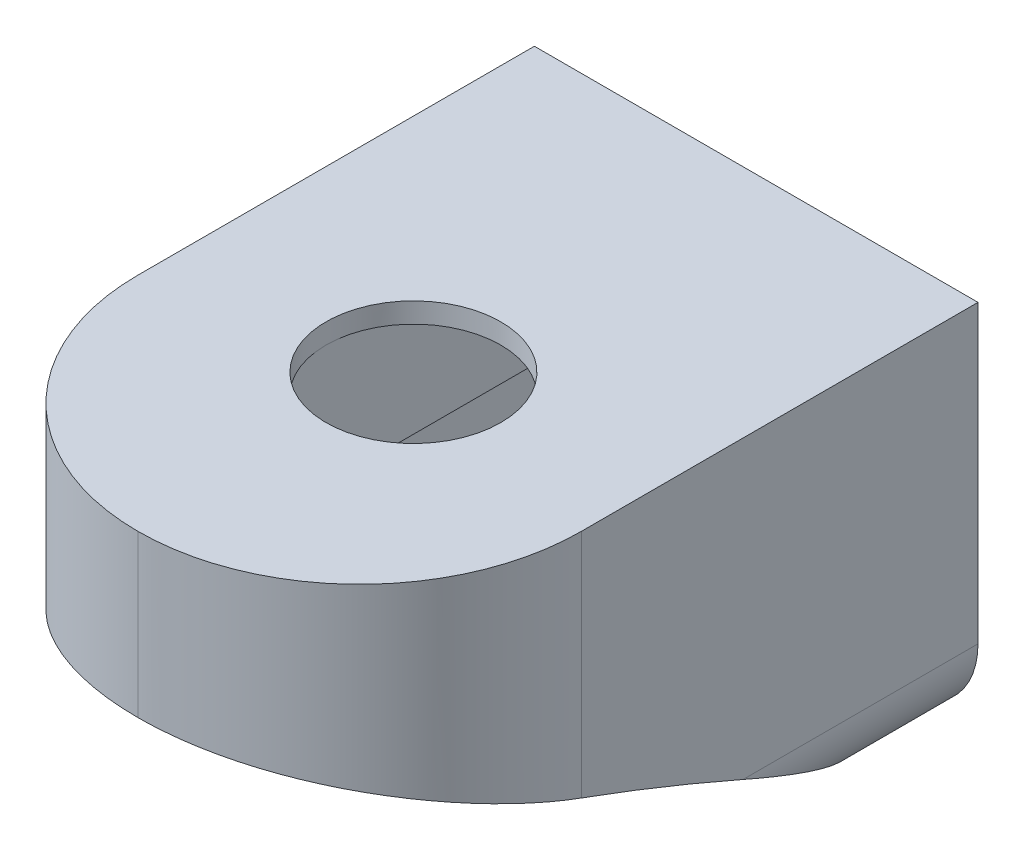
from build123d import *

# Parameters (mm, degrees)
SKETCH1_W           = 33
SKETCH1_H           = 28
BOSS_EXTRUDE1_DEPTH = 46
CUT_EXTRUDE1_DEPTH  = 59.318093247
CUT_EXTRUDE2_START  = -3
CUT_EXTRUDE2_DEPTH  = 27
FILLET1_R           = 12.5
FILLET2_R           = 16.5
FILLET3_R           = 6
SKETCH4_W           = 13
SKETCH4_H           = 23
CUT_EXTRUDE3_DEPTH  = 9
SKETCH5_R           = 6.5
CUT_EXTRUDE4_DEPTH  = 56.592265809
SKETCH6_R           = 1
CUT_EXTRUDE6_DEPTH  = 8
SKETCH7_R           = 1.3
SKETCH7_R_2         = 2.5
CUT_EXTRUDE7_DEPTH  = 2.5


with BuildPart() as part:
    # Sketch1 → Boss-Extrude1 (new body)
    with BuildSketch(Plane.XY):
        Rectangle(SKETCH1_W, SKETCH1_H)
    extrude(amount=BOSS_EXTRUDE1_DEPTH)

    # Sketch2 → Cut-Extrude1 (cut, through all)
    with BuildSketch(Plane(origin=(16.5, 0, 0), x_dir=(0, 0, -1), z_dir=(1, 0, 0))):
        with BuildLine():
            Line((-46, 2), (-46, -14))
            Line((-46, -14), (-5, -14))
            add(Edge.make_bspline(
                [(-5, -14), (-24.736297584, -3.666123858), (-46, 2)],
                knots=[0, 0, 0, 1, 1, 1], degree=2))
        make_face()
    extrude(amount=-CUT_EXTRUDE1_DEPTH, mode=Mode.SUBTRACT)

    # Sketch3 → Cut-Extrude2 (cut)
    with BuildSketch(Plane(origin=(16.5, 0, 0), x_dir=(0, 0, -1), z_dir=(1, 0, 0)).offset(CUT_EXTRUDE2_START)):
        with BuildLine():
            Line((-5, -14), (-2.5, -14))
            Line((-2.5, -14), (-2.5, 3.5))
            Line((-2.5, 3.5), (-40.5, 3.5))
            Line((-40.5, 3.5), (-40.5, 0.448741524))
            add(Edge.make_bspline(
                [(-5, -14), (-22.171866916, -5.008853353), (-40.5, 0.448741524)],
                knots=[0, 0, 0, 1, 1, 1], degree=2))
        make_face()
    extrude(amount=-CUT_EXTRUDE2_DEPTH, mode=Mode.SUBTRACT)

    # Fillet1
    fillet1_edges = [part.edges().sort_by_distance(p)[0] for p in [
        (13.5, 1.974370762, 40.5),
        (-13.5, 1.974370762, 40.5),
    ]]
    fillet(fillet1_edges, radius=FILLET1_R)

    # Fillet2
    fillet2_edges = [part.edges().sort_by_distance(p)[0] for p in [
        (16.5, 8, 46),
        (-16.5, 8, 46),
    ]]
    fillet(fillet2_edges, radius=FILLET2_R - 0.0001)  # a hair under: the kernel refuses the full size

    # Fillet3
    fillet3_edges = [part.edges().sort_by_distance(p)[0] for p in [
        (-16.5, -14, 2.5),
        (16.5, -14, 2.5),
    ]]
    fillet(fillet3_edges, radius=FILLET3_R)

    # Sketch4 → Cut-Extrude3 (cut)
    with BuildSketch(Plane.XZ.offset(-3.5)):
        with Locations((0, 20.5)):
            Rectangle(SKETCH4_W, SKETCH4_H)
    extrude(amount=-CUT_EXTRUDE3_DEPTH, mode=Mode.SUBTRACT)

    # Sketch5 → Cut-Extrude4 (cut, through all)
    with BuildSketch(Plane.XZ.offset(-12.5)):
        with Locations((0, 25.5)):
            Circle(SKETCH5_R)
    extrude(amount=-CUT_EXTRUDE4_DEPTH, mode=Mode.SUBTRACT)

    # Sketch6 → Cut-Extrude6 (cut)
    with BuildSketch(Plane.XZ.offset(-3.5)):
        with Locations((0, 34.3)):
            Circle(SKETCH6_R)
        with Locations((0, 6.7)):
            Circle(SKETCH6_R)
    extrude(amount=-CUT_EXTRUDE6_DEPTH, mode=Mode.SUBTRACT)

    # Sketch7 → Cut-Extrude7 (cut)
    with BuildSketch(Plane(origin=(0, 0, 0), x_dir=(-1, 0, 0), z_dir=(0, 0, -1))):
        with Locations((-9.5, 0)):
            Circle(SKETCH7_R)
        with Locations((-5, 0)):
            Circle(SKETCH7_R_2)
        with Locations((-0.5, 0)):
            Circle(SKETCH7_R)
    extrude(amount=-CUT_EXTRUDE7_DEPTH, mode=Mode.SUBTRACT)


solid = part.part
